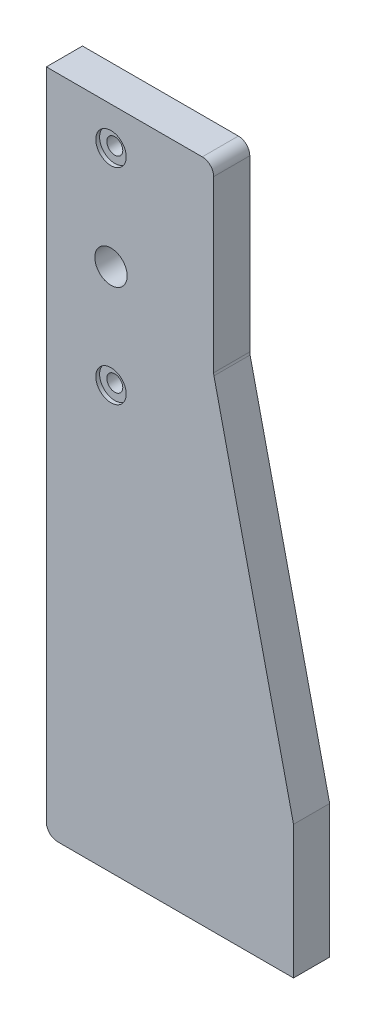
from build123d import *

# Parameters (mm, degrees)
EXTRUDE_1_DEPTH     = 9.5
SKETCH_6_R          = 2.1
CUT_EXTRUDE_5_DEPTH = 187.923112536
SKETCH_7_R          = 4
CUT_EXTRUDE_6_DEPTH = 1
FILLET_1_R          = 3
SKETCH_8_R          = 4.25
CUT_EXTRUDE_7_DEPTH = 10


with BuildPart() as part:
    # 草图5 → 凸台-拉伸1 (new body)
    with BuildSketch(Plane.XY):
        Polygon((0, 0), (0, 175), (44, 175), (44, 127), (65, 35), (65, 0), align=None)
    extrude(amount=EXTRUDE_1_DEPTH)

    # 草图6 → 切除-拉伸5 (cut, through all)
    with BuildSketch(Plane.XY.offset(9.5)):
        with Locations((17, 165)):
            Circle(SKETCH_6_R)
        with Locations((17, 111)):
            Circle(SKETCH_6_R)
    extrude(amount=-CUT_EXTRUDE_5_DEPTH, mode=Mode.SUBTRACT)

    # 草图7 → 切除-拉伸6 (cut)
    with BuildSketch(Plane.XY.offset(9.5)):
        with Locations((17, 165)):
            Circle(SKETCH_7_R)
        with Locations((17, 111)):
            Circle(SKETCH_7_R)
    extrude(amount=-CUT_EXTRUDE_6_DEPTH, mode=Mode.SUBTRACT)

    # 圆角1
    fillet_1_edges = [part.edges().sort_by_distance(p)[0] for p in [
        (0, 0, 4.75),
        (44, 127, 4.75),
        (44, 175, 4.75),
    ]]
    fillet(fillet_1_edges, radius=FILLET_1_R)

    # 草图8 → 切除-拉伸7 (cut)
    with BuildSketch(Plane.XY.offset(9.5)):
        with Locations((17, 138)):
            Circle(SKETCH_8_R)
    extrude(amount=-CUT_EXTRUDE_7_DEPTH, mode=Mode.SUBTRACT)


solid = part.part
